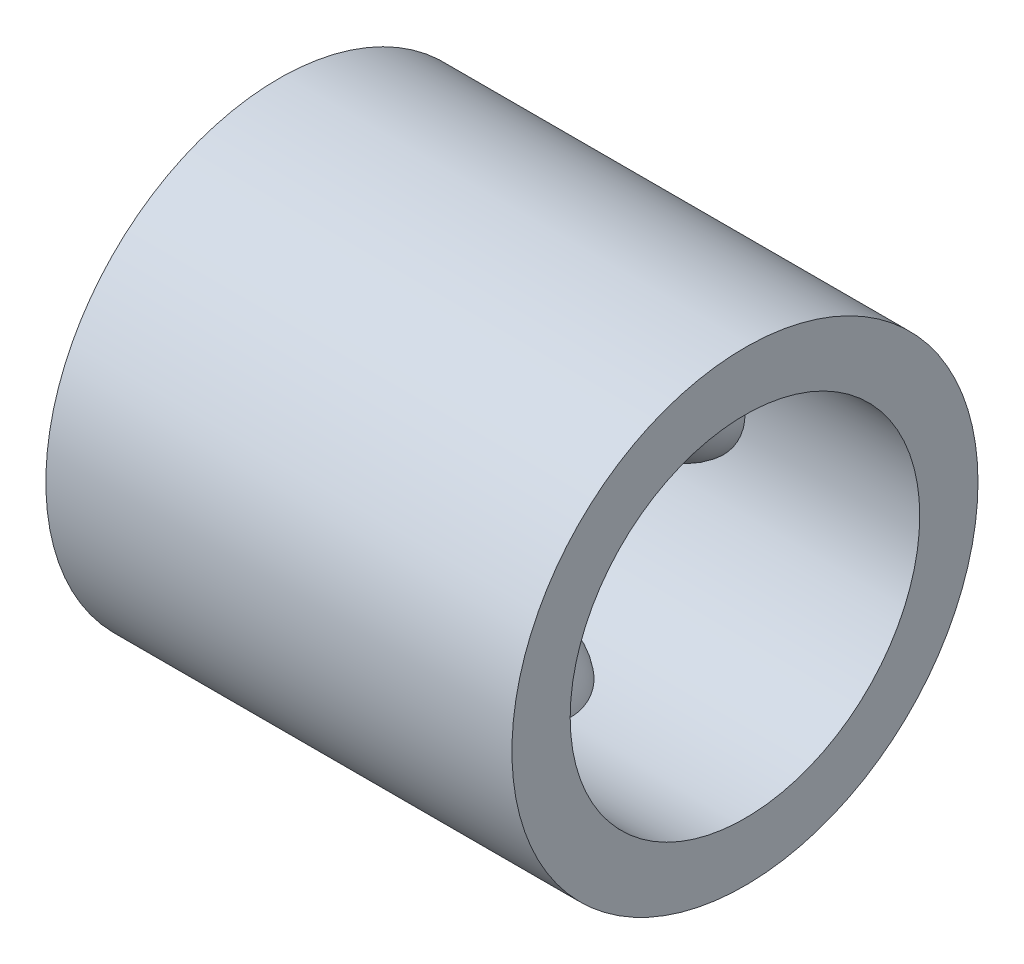
from build123d import *

# Parameters (mm, degrees)
SKETCH2_R           = 3
SKETCH2_R_2         = 2.25
BOSS_EXTRUDE1_DEPTH = 3


with BuildPart() as part:
    # Sketch2 → Boss-Extrude1 (new, symmetric)
    with BuildSketch(Plane(origin=(0, 0, 0), x_dir=(0, 0, -1), z_dir=(1, 0, 0))):
        Circle(SKETCH2_R)
        Circle(SKETCH2_R_2, mode=Mode.SUBTRACT)
    extrude(amount=BOSS_EXTRUDE1_DEPTH, both=True)

    # Sketch8 → Revolve18 (revolve)
    with BuildSketch(Plane(origin=(0, 0, 0), x_dir=(0, 0, -1), z_dir=(1, 0, 0))):
        with BuildLine():
            Line((-2.25, 0), (-2.237739596, 0.750859778))
            ThreePointArc((-2.237739596, 0.750859778), (-1.7107227, 0.52222122), (-1.500084905, -0.012244979))
            Line((-1.500084905, -0.012244979), (-2.25, 0))
        make_face()
    revolve(axis=Axis((0, 0, 2.25), (0, -0.016326311142728266, -0.999866716900043)))

    # Sketch10 → Revolve19 (revolve)
    with BuildSketch(Plane(origin=(0, 0, 0), x_dir=(0, 0, -1), z_dir=(1, 0, 0))):
        with BuildLine():
            Line((2.25, 0), (2.25, 0.75))
            ThreePointArc((2.25, 0.75), (1.719669914, 0.530330086), (1.5, 0))
            Line((1.5, 0), (2.25, 0))
        make_face()
    revolve(axis=Axis((0, 0, -2.25), (0, 0, 1)))


with BuildPart() as revolve20_tool:
    # Sketch11 → Revolve20 (revolve)
    with BuildSketch(Plane(origin=(0, 0, 0), x_dir=(0, 0, -1), z_dir=(1, 0, 0))):
        with BuildLine():
            Line((0.001073711, 2.249994313), (-0.749995081, 2.251069562))
            ThreePointArc((-0.749995081, 2.251069562), (-0.53070663, 1.720048449), (0, 1.5))
            Line((0, 1.5), (0.001073711, 2.249994313))
        make_face()
    revolve(axis=Axis((0, 2.249994313, -0.001073711), (0, -0.9999989752258402, 0.0014316239972306517)))


with BuildPart() as part_1:
    add(part.part)


with BuildPart() as part_2:
    # Revolve20: joined with revolve20_tool
    add(part_1.part.fuse(revolve20_tool.part, tol=0.00001))

    # Sketch13 → Revolve21 (revolve)
    with BuildSketch(Plane(origin=(0, 0, 0), x_dir=(0, 0, -1), z_dir=(1, 0, 0))):
        with BuildLine():
            Line((0, -1.5), (0, -2.25))
            Line((0, -2.25), (0.75, -2.25))
            ThreePointArc((0.75, -2.25), (0.530330086, -1.719669914), (0, -1.5))
        make_face()
    revolve(axis=Axis((0, -1.5, 0), (0, -1, 0)))


solid = part_2.part
